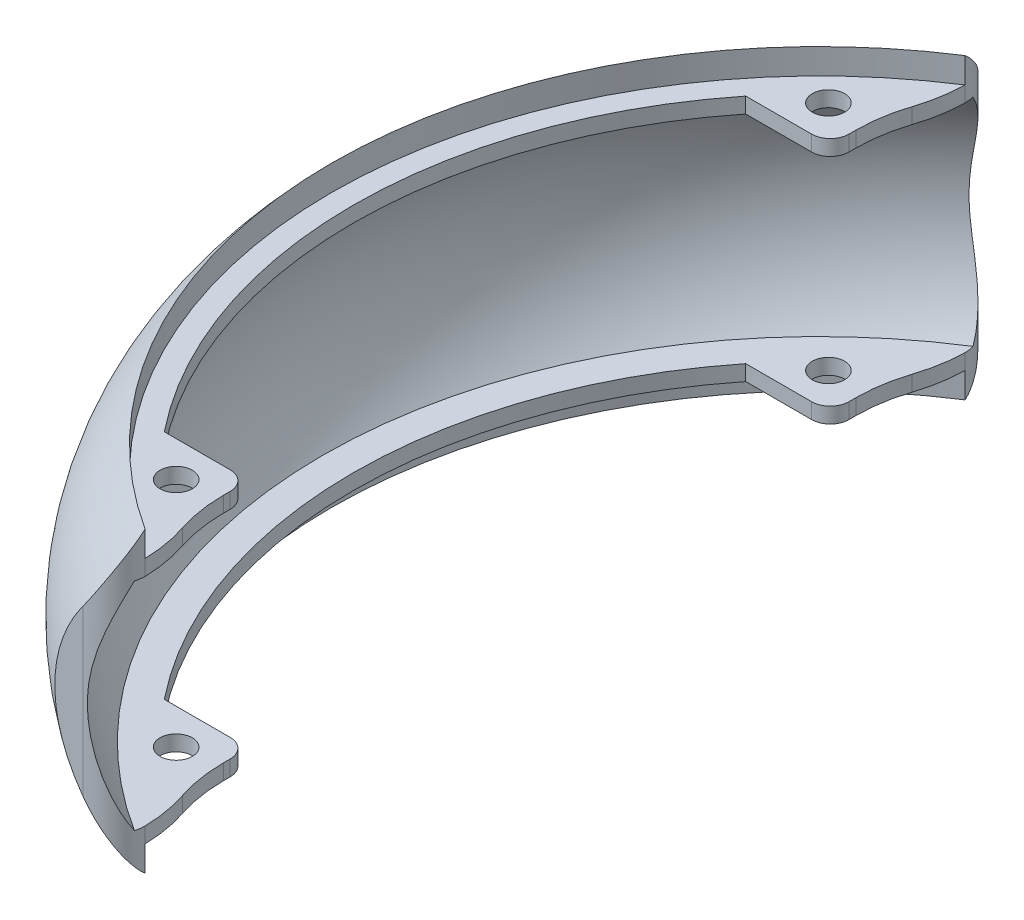
from build123d import *

# Parameters (mm, degrees)
REVOLVE1_ANGLE          = 120.922435
CUT_EXTRUDE1_DEPTH      = 120.118916294
CUT_EXTRUDE1_DEPTH_BACK = 120.118916294
BOSS_EXTRUDE2_DEPTH     = 2.5
CUT_EXTRUDE2_REACH      = 123.312
SKETCH5_R               = 2.6
MIRROR4_COPY_1_DEPTH    = 2.5
MIRROR4_COPY_2_REACH    = 123.312
MIRROR4_COPY_2_SKETCH_R = 2.6
FILLET2_R               = 25
FILLET3_START           = -21
FILLET3_DEPTH           = 42


with BuildPart() as part:
    # Revolve1: read off the stored shape, not the designer's step
    # Revolve1 outline → Revolve1 (revolve)
    with BuildSketch(Plane(origin=(0, 0, 0), x_dir=(-0.49301257198087967, 0, -0.8700221858486127), z_dir=(0.8700221858486127, 0, -0.49301257198087967))):
        with BuildLine():
            Line((78.5, 24), (78.5, 19.9))
            Line((78.5, 19.9), (75, 19.9))
            Line((75, 19.9), (75, 17.4))
            Line((75, 17.4), (79.88043342, 17.4))
            ThreePointArc((79.88043342, 17.4), (85.024521594, 0), (79.88043342, -17.4))
            Line((79.88043342, -17.4), (75, -17.4))
            Line((75, -17.4), (75, -19.9))
            Line((75, -19.9), (78.5, -19.9))
            Line((78.5, -19.9), (78.5, -24))
            ThreePointArc((78.5, -24), (88.024521594, 0), (78.5, 24))
        make_face()
    revolve(axis=Axis((0, 0, 0), (0, 1, 0)), revolution_arc=REVOLVE1_ANGLE)

    # Sketch3 → Cut-Extrude1 (cut, two sides: drawn at the far end of the back side and taken through both)
    with BuildSketch(Plane(origin=(0, 0, 0), x_dir=(1, 0, 0), z_dir=(0, 1, 0)).offset(-CUT_EXTRUDE1_DEPTH_BACK)):
        with BuildLine():
            Line((-42.5, -66), (-42.5, 66))
            ThreePointArc((-42.5, 66), (-43.964466094, 69.535533906), (-47.5, 71))
            Line((-47.5, 71), (-70.072780864, 71))
            Line((-70.072780864, 71), (-70.072780864, 87.352336772))
            Line((-70.072780864, 87.352336772), (-35.072780864, 87.352336772))
            Line((-35.072780864, 87.352336772), (-35.072780864, -87.352336772))
            Line((-35.072780864, -87.352336772), (-70.072780864, -87.352336772))
            Line((-70.072780864, -87.352336772), (-70.072780864, -71))
            Line((-70.072780864, -71), (-47.5, -71))
            ThreePointArc((-47.5, -71), (-43.964466094, -69.535533906), (-42.5, -66))
        make_face()
    extrude(amount=CUT_EXTRUDE1_DEPTH + CUT_EXTRUDE1_DEPTH_BACK, mode=Mode.SUBTRACT)

    # Sketch4 → Boss-Extrude2 (add)
    with BuildSketch(Plane.XZ.offset(-17.4)):
        with BuildLine():
            Line((-58.609991163, 46.796035472), (-48, 46.796035472))
            ThreePointArc((-48, 46.796035472), (-45.878679656, 47.674715128), (-45, 49.796035472))
            Line((-45, 49.796035472), (-45, 60))
            ThreePointArc((-45, 60), (-52.223976649, 53.829882621), (-58.609991163, 46.796035472))
        make_face()
    boss_extrude2 = extrude(amount=-BOSS_EXTRUDE2_DEPTH)

    # Sketch5 → Cut-Extrude2 (cut, up to next)
    with BuildSketch(Plane(origin=(0, 19.9, 0), x_dir=(1, 0, 0), z_dir=(0, 1, 0)), mode=Mode.PRIVATE) as cut_extrude2_sk1:
        with Locations(Location((-51, -52.496035472, 0), (0, 0, 270))):
            Circle(SKETCH5_R)
    cut_extrude2_tool1 = extrude(cut_extrude2_sk1.sketch, amount=-CUT_EXTRUDE2_REACH, mode=Mode.PRIVATE) & part.part
    cut_extrude2 = cut_extrude2_tool1.solids().sort_by_distance((-51, 19.9, 52.496035))[0]
    add(cut_extrude2, mode=Mode.SUBTRACT)

    # Mirror3: Boss-Extrude2, Cut-Extrude2 across plane
    add(boss_extrude2.mirror(Plane.XY))
    add(cut_extrude2.mirror(Plane.XY), mode=Mode.SUBTRACT)

    # Mirror4: Boss-Extrude2, Cut-Extrude2 across plane
    add(boss_extrude2.mirror(Plane.ZX))
    add(cut_extrude2.mirror(Plane.ZX), mode=Mode.SUBTRACT)

    # Mirror4 copy 1 sketch → Mirror4 copy 1 (add)
    with BuildSketch(Plane(origin=(0, -17.4, 0), x_dir=(1, 0, 0), z_dir=(0, 1, 0))):
        with BuildLine():
            Line((-58.609991163, 46.796035472), (-48, 46.796035472))
            ThreePointArc((-48, 46.796035472), (-45.878679656, 47.674715128), (-45, 49.796035472))
            Line((-45, 49.796035472), (-45, 60))
            ThreePointArc((-45, 60), (-52.223976649, 53.829882621), (-58.609991163, 46.796035472))
        make_face()
    extrude(amount=-MIRROR4_COPY_1_DEPTH)

    # Mirror4 copy 2 sketch → Mirror4 copy 2 (cut, up to next)
    with BuildSketch(Plane.XZ.offset(19.9), mode=Mode.PRIVATE) as mirror4_copy_2_sk1:
        with Locations(Location((-51, -52.496035472, 0), (0, 0, 270))):
            Circle(MIRROR4_COPY_2_SKETCH_R)
    mirror4_copy_2_tool1 = extrude(mirror4_copy_2_sk1.sketch, amount=-MIRROR4_COPY_2_REACH, mode=Mode.PRIVATE) & part.part
    add(mirror4_copy_2_tool1.solids().sort_by_distance((-51, -19.9, -52.496035))[0], mode=Mode.SUBTRACT)

    # Fillet2
    # the kernel refuses this fillet: 25 mm, written as the material it adds along each edge
    with BuildSketch(Plane(origin=(-45, 17.4, 60), x_dir=(0.8121446027945783, 0, 0.5834562058557923), z_dir=(0, 1, 0)), Plane(origin=(-45, -17.4, -60), x_dir=(0.812144602794579, 0, -0.5834562058557914), z_dir=(0, -1, 0))) as fillet2_piece_1:
        with BuildLine():
            CenterArc((14.993456513, 21.97790526), FILLET2_R, 215.694002743, 25.841932763)
            Line((-5.310158556, 7.391500113), (-5.716230858, 7.09977201))
            Line((-5.716230858, 7.09977201), (-0.406072301, -0.291728103))
            Line((-0.406072301, -0.291728103), (-0.010260898, -0.499894703))
            ThreePointArc((-0.010260898, -0.499894703), (1.539134774, -0.515794569), (2.83996581, -0.439558105))
            Line((2.83996581, -0.439558105), (3.078269549, 0))
        make_face()
    extrude(amount=2.5)
    with BuildSketch(Plane(origin=(-45, -17.4, 60), x_dir=(0.8121446027945783, 0, 0.5834562058557923), z_dir=(0, -1, 0)), Plane(origin=(-45, 17.4, -60), x_dir=(0.812144602794579, 0, -0.5834562058557914), z_dir=(0, 1, 0))) as fillet2_piece_2:
        with BuildLine():
            CenterArc((14.993456513, -21.97790526), FILLET2_R, 118.464064493, 25.841932763)
            Line((-5.310158556, -7.391500113), (-5.716230858, -7.09977201))
            Line((-5.716230858, -7.09977201), (-0.406072301, 0.291728103))
            Line((-0.406072301, 0.291728103), (-0.010260898, 0.499894703))
            ThreePointArc((-0.010260898, 0.499894703), (1.539134774, 0.515794569), (2.83996581, 0.439558105))
            Line((2.83996581, 0.439558105), (3.078269549, 0))
        make_face()
    extrude(amount=2.5)

    # Fillet3: read off the stored shape, not the designer's step
    # Fillet3 outline → Fillet3 (cut)
    with BuildSketch(Plane(origin=(0, 0, 0), x_dir=(1, 0, 0), z_dir=(0, 1, 0)).offset(FILLET3_START)):
        with BuildLine():
            ThreePointArc((-42.5, -61.796035472), (-43.174912338, -60.275537983), (-43.747209157, -58.713521457))
            ThreePointArc((-43.747209157, -58.713521457), (-42.852791856, -62.310406361), (-42.5, -66))
            Line((-42.5, -66), (-42.5, -61.796035472))
        make_face()
        with BuildLine():
            ThreePointArc((-42.5, 66), (-42.852791856, 62.310406361), (-43.747209157, 58.713521457))
            ThreePointArc((-43.747209157, 58.713521457), (-43.174912338, 60.275537983), (-42.5, 61.796035472))
            Line((-42.5, 61.796035472), (-42.5, 66))
        make_face()
    extrude(amount=FILLET3_DEPTH, mode=Mode.SUBTRACT)


solid = part.part
